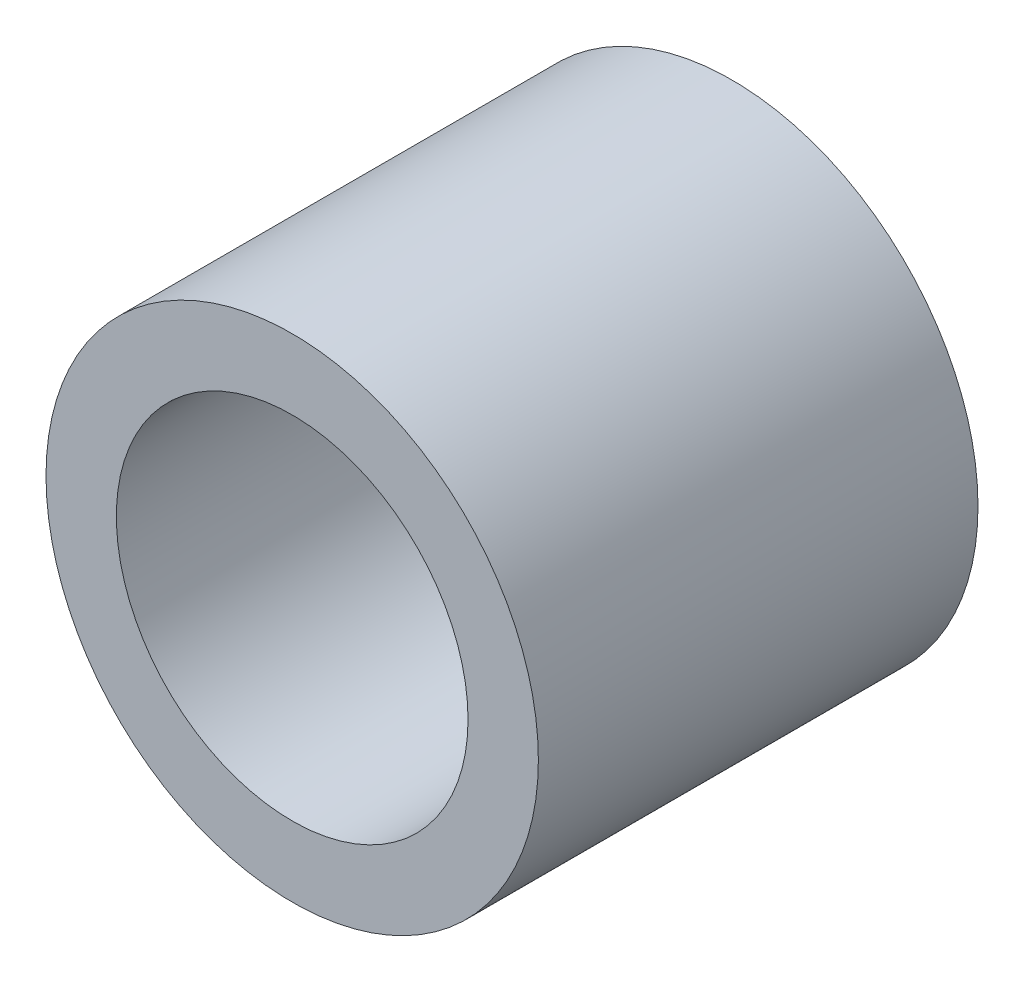
from build123d import *

# Parameters (mm, degrees)
SKETCH1_R           = 4.445
SKETCH1_R_2         = 3.175
BOSS_EXTRUDE1_DEPTH = 7.9375


with BuildPart() as part:
    # Sketch1 → Boss-Extrude1 (new body)
    with BuildSketch(Plane.XY):
        Circle(SKETCH1_R)
        Circle(SKETCH1_R_2, mode=Mode.SUBTRACT)
    extrude(amount=BOSS_EXTRUDE1_DEPTH)


solid = part.part
